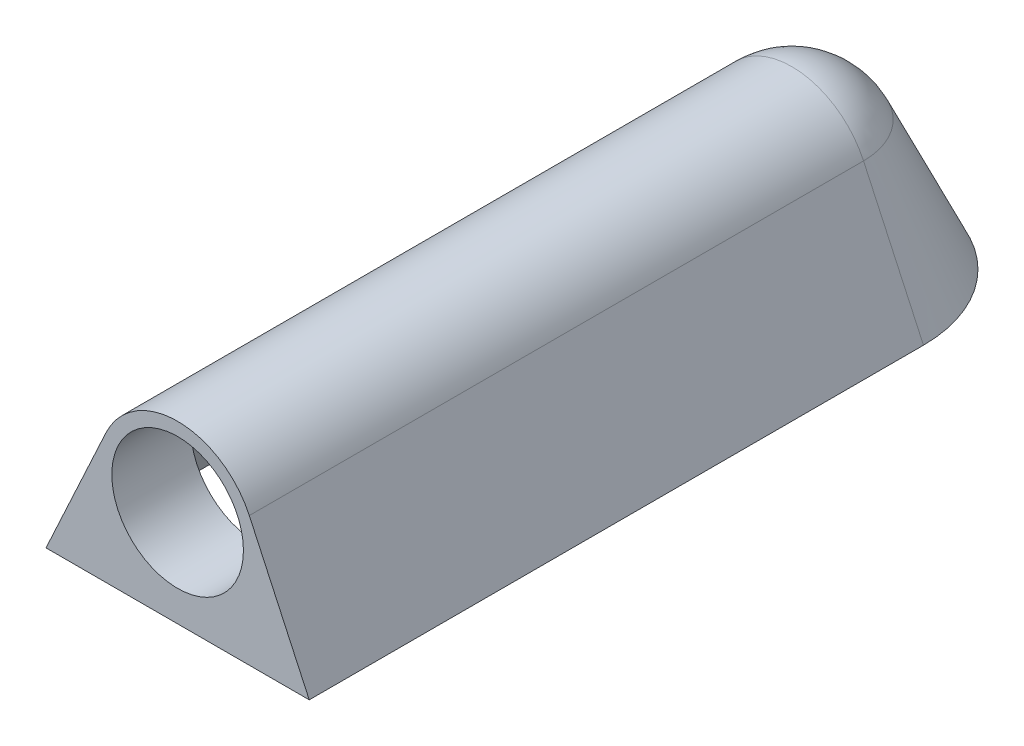
from build123d import *

# Parameters (mm, degrees)
REVOLVE1_ANGLE      = 180
BOSS_EXTRUDE1_DEPTH = 70
SKETCH4_R           = 7.5
CUT_EXTRUDE1_DEPTH  = 9
SHELL1_DEPTH        = 61
SHELL1_START        = 61
SHELL1_2_DEPTH      = 8
SHELL1_3_ANGLE      = 180


with BuildPart() as part:
    # Sketch2 → Revolve1 (revolve)
    with BuildSketch(Plane.XY):
        with BuildLine():
            Line((0, 0), (0, 20))
            ThreePointArc((0, 20), (4.848310738, 18.582472089), (8.169373523, 14.776418441))
            Line((8.169373523, 14.776418441), (15, 0))
            Line((15, 0), (0, 0))
        make_face()
    revolve(axis=Axis((0, 0, 0), (0, 1, 0)), revolution_arc=REVOLVE1_ANGLE)

    # Sketch3 → Boss-Extrude1 (add)
    with BuildSketch(Plane.XY):
        with BuildLine():
            Line((-15, 0), (15, 0))
            Line((15, 0), (8.169373523, 14.776418441))
            ThreePointArc((8.169373523, 14.776418441), (0, 20), (-8.169373523, 14.776418441))
            Line((-8.169373523, 14.776418441), (-15, 0))
        make_face()
    extrude(amount=BOSS_EXTRUDE1_DEPTH)

    # Sketch4 → Cut-Extrude1 (cut)
    with BuildSketch(Plane.XY.offset(70)):
        with Locations((0, 11)):
            Circle(SKETCH4_R)
    extrude(amount=-CUT_EXTRUDE1_DEPTH, mode=Mode.SUBTRACT)

    # Shell1: read off the stored shape, not the designer's step
    # Shell1 outline → Shell1 (cut)
    with BuildSketch(Plane.XY):
        with BuildLine():
            Line((-13.898324336, 0), (13.898324336, 0))
            Line((13.898324336, 0), (7.261665354, 14.356816392))
            ThreePointArc((7.261665354, 14.356816392), (0, 19), (-7.261665354, 14.356816392))
            Line((-7.261665354, 14.356816392), (-13.898324336, 0))
        make_face()
    extrude(amount=SHELL1_DEPTH, mode=Mode.SUBTRACT)

    # Shell1 2 outline → Shell1 2 (cut)
    with BuildSketch(Plane.XY.offset(SHELL1_START)):
        with BuildLine():
            Line((-8.466880482, 11.74962317), (-13.898324336, 0))
            Line((-13.898324336, 0), (13.898324336, 0))
            Line((13.898324336, 0), (8.466880482, 11.74962317))
            ThreePointArc((8.466880482, 11.74962317), (0, 2.5), (-8.466880482, 11.74962317))
        make_face()
    extrude(amount=SHELL1_2_DEPTH, mode=Mode.SUBTRACT)

    # Shell1 3 outline → Shell1 3 (revolve, cut)
    with BuildSketch(Plane.XY):
        with BuildLine():
            Line((13.898324336, 0), (7.261665354, 14.356816392))
            ThreePointArc((7.261665354, 14.356816392), (4.309609545, 17.73997519), (0, 19))
            Line((0, 19), (0, 0))
            Line((0, 0), (13.898324336, 0))
        make_face()
    revolve(axis=Axis((0, 0, 0), (0, 1, 0)), revolution_arc=SHELL1_3_ANGLE, mode=Mode.SUBTRACT)


solid = part.part
